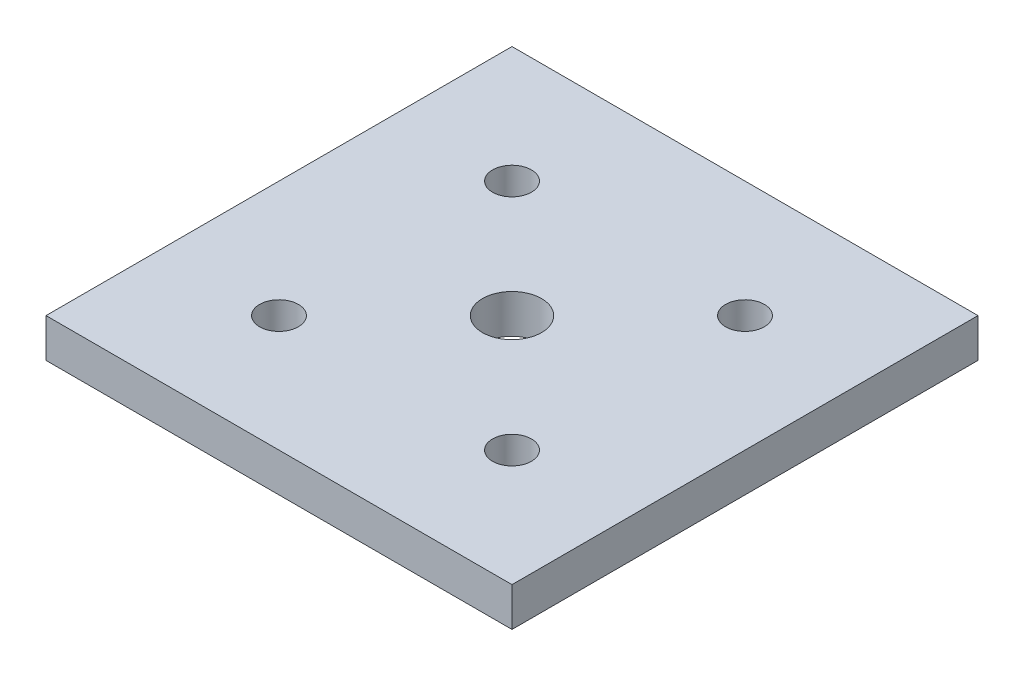
from build123d import *

# Parameters (mm, degrees)
SKETCH1_W           = 60
SKETCH1_H           = 60
SKETCH1_R           = 3.8
SKETCH1_R_2         = 2.5
BOSS_EXTRUDE1_DEPTH = 5


with BuildPart() as part:
    # Sketch1 → Boss-Extrude1 (new body)
    with BuildSketch(Plane(origin=(0, 0, 0), x_dir=(1, 0, 0), z_dir=(0, 1, 0))):
        Rectangle(SKETCH1_W, SKETCH1_H)
        Circle(SKETCH1_R, mode=Mode.SUBTRACT)
        with Locations((-15, 15)):
            Circle(SKETCH1_R_2, mode=Mode.SUBTRACT)
        with Locations((15, 15)):
            Circle(SKETCH1_R_2, mode=Mode.SUBTRACT)
        with Locations((15, -15)):
            Circle(SKETCH1_R_2, mode=Mode.SUBTRACT)
        with Locations((-15, -15)):
            Circle(SKETCH1_R_2, mode=Mode.SUBTRACT)
    extrude(amount=BOSS_EXTRUDE1_DEPTH)


solid = part.part
